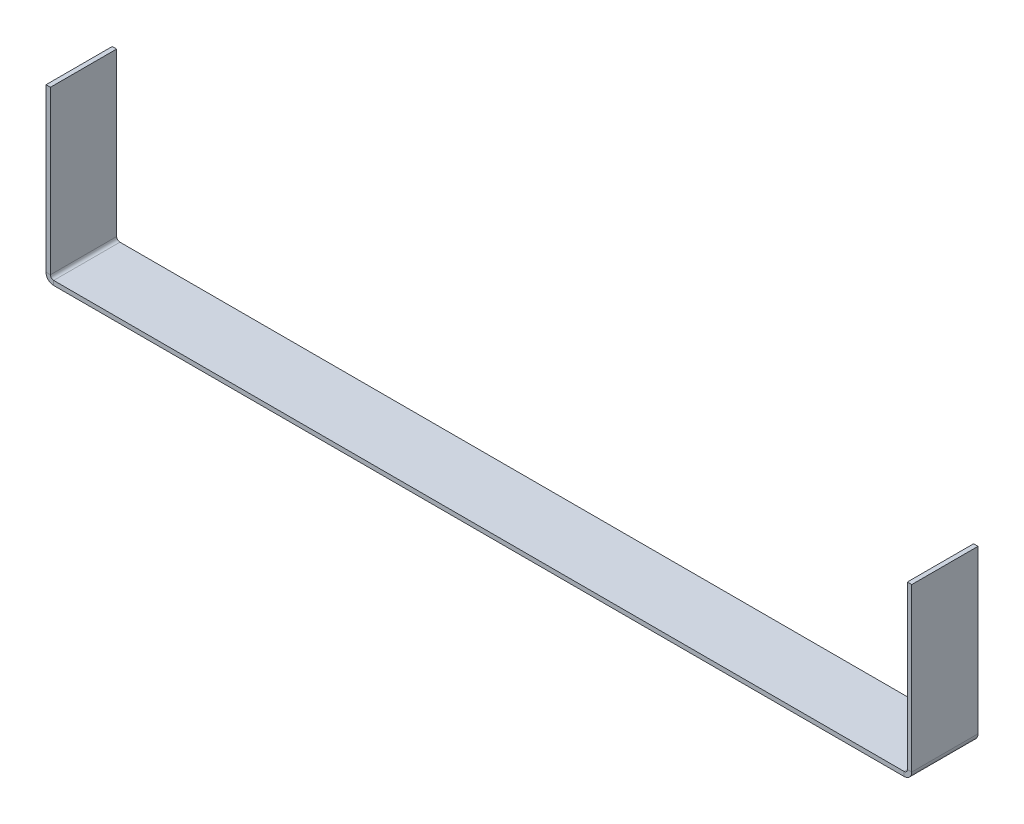
from build123d import *

# Parameters (mm, degrees)
SKETCH_1_W                       = 196
SKETCH_1_H                       = 15
SM_BASE_FLANGE_1_DEPTH           = 1
SM_EDGE_FLANGE_1_STRIP_W         = 5.4732
SM_EDGE_FLANGE_1_STRIP_H         = 1
SM_EDGE_FLANGE_1_STRIP_CUT_DEPTH = 15
SM_EDGE_FLANGE_1_DEPTH           = 15
SM_EDGE_FLANGE_2_STRIP_W         = 5.4732
SM_EDGE_FLANGE_2_STRIP_H         = 1
SM_EDGE_FLANGE_2_STRIP_CUT_DEPTH = 15
SM_EDGE_FLANGE_2_DEPTH           = 15


# Sheet-metal steps are written as plain solids
with BuildPart() as part:
    # Sketch 1 → Базовая кромка1 (new body)
    with BuildSketch(Plane(origin=(0, 0, 0), x_dir=(1, 0, 0), z_dir=(0, 1, 0))):
        with Locations((98, 7.5)):
            Rectangle(SKETCH_1_W, SKETCH_1_H)
    extrude(amount=-SM_BASE_FLANGE_1_DEPTH)

    # Ребро-кромка1 strip (across the edge) → Ребро-кромка1 strip cut (cut)
    with BuildSketch(Plane.XY.offset(-15)):
        with Locations((-1, -0.5)):
            Rectangle(SM_EDGE_FLANGE_1_STRIP_W, SM_EDGE_FLANGE_1_STRIP_H)
    extrude(amount=SM_EDGE_FLANGE_1_STRIP_CUT_DEPTH, mode=Mode.SUBTRACT)

    # Ребро-кромка1 section (across the edge) → Ребро-кромка1 (add)
    with BuildSketch(Plane.XY.offset(-15)):
        with BuildLine():
            Line((0, 0.7366), (0, 37.5))
            Line((0, 37.5), (1, 37.5))
            Line((1, 37.5), (1, 0.7366))
            ThreePointArc((1, 0.7366), (1.215745145, 0.215745145), (1.7366, 0))
            Line((1.7366, 0), (1.7366, -1))
            ThreePointArc((1.7366, -1), (0.508638364, -0.491361636), (0, 0.7366))
        make_face()
    extrude(amount=SM_EDGE_FLANGE_1_DEPTH)

    # Ребро-кромка2 strip (across the edge) → Ребро-кромка2 strip cut (cut)
    with BuildSketch(Plane(origin=(196, 0, 0), x_dir=(-1, 0, 0), z_dir=(0, 0, -1))):
        with Locations((-1, -0.5)):
            Rectangle(SM_EDGE_FLANGE_2_STRIP_W, SM_EDGE_FLANGE_2_STRIP_H)
    extrude(amount=SM_EDGE_FLANGE_2_STRIP_CUT_DEPTH, mode=Mode.SUBTRACT)

    # Ребро-кромка2 section (across the edge) → Ребро-кромка2 (add)
    with BuildSketch(Plane(origin=(196, 0, 0), x_dir=(-1, 0, 0), z_dir=(0, 0, -1))):
        with BuildLine():
            Line((0, 0.7366), (0, 37.5))
            Line((0, 37.5), (1, 37.5))
            Line((1, 37.5), (1, 0.7366))
            ThreePointArc((1, 0.7366), (1.215745145, 0.215745145), (1.7366, 0))
            Line((1.7366, 0), (1.7366, -1))
            ThreePointArc((1.7366, -1), (0.508638364, -0.491361636), (0, 0.7366))
        make_face()
    extrude(amount=SM_EDGE_FLANGE_2_DEPTH)


solid = part.part
